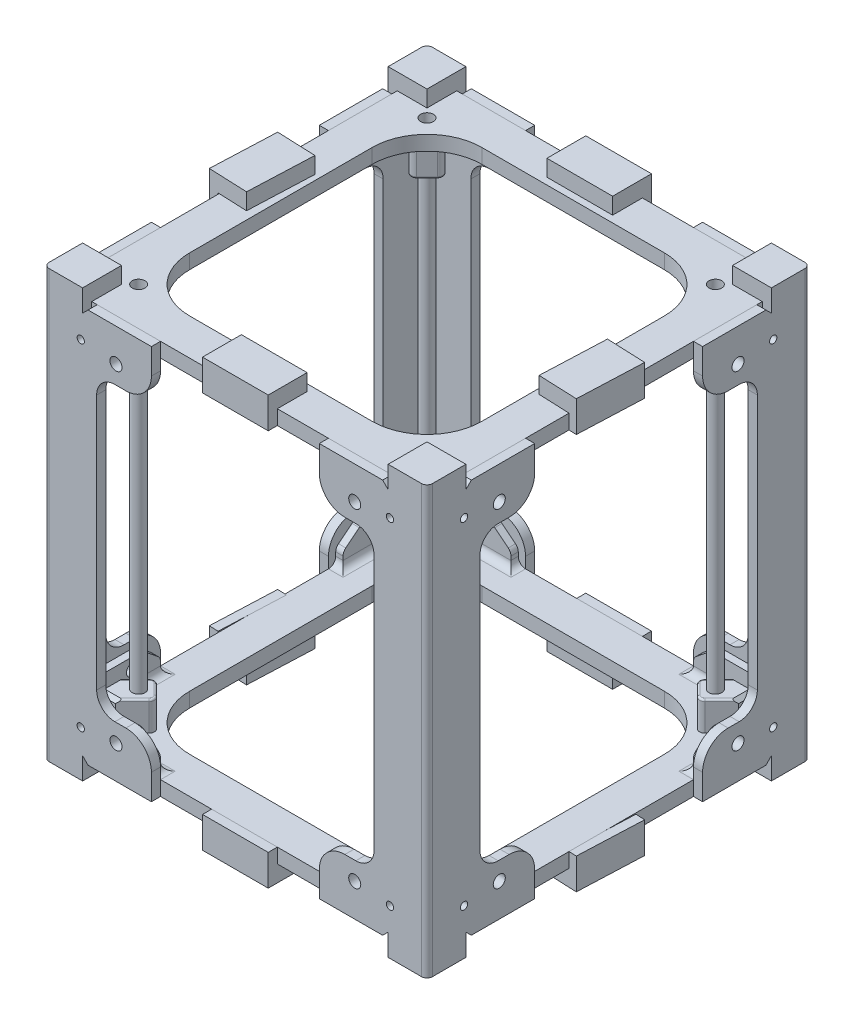
from build123d import *

# Parameters (mm, degrees)
SKETCH4_W                = 100
SKETCH4_H                = 100
BOTTOM_PLATFORM_DEPTH    = 4
BOSS_EXTRUDE6_DEPTH      = 2.5
SKETCH9_W                = 8.15
SKETCH9_H                = 8.15
BOSS_EXTRUDE12_DEPTH     = 4.5
SKETCH10_W               = 2.5
SKETCH10_H               = 2.5
BOSS_EXTRUDE13_DEPTH     = 58.5
BOSS_EXTRUDE14_DEPTH     = 2
SKETCH12_W               = 2
SKETCH12_H               = 2
BOSS_EXTRUDE15_DEPTH     = 8
FILLET1_R                = 2
FILLET2_R                = 2
FILLET5_R                = 2
SKETCH13_R               = 1.75
BOSS_EXTRUDE16_DEPTH     = 8
SKETCH13_3_R             = 1.75
BOSS_EXTRUDE17_DEPTH     = 50
SKETCH14_R               = 1
CUT_EXTRUDE2_DEPTH       = 9
SKETCH13_4_R             = 1.75
CUT_EXTRUDE3_DEPTH       = 132.471479797
CHAMFER1_SIZE            = 1
FILLET6_R                = 0.5
CUT_EXTRUDE4_START       = -4.5
SKETCH15_R               = 1.65
CUT_EXTRUDE4_DEPTH       = 4.5
MIRROR24_COPY_1_SKETCH_R = 1
MIRROR24_COPY_1_DEPTH    = 9
MIRROR24_START           = -4.5
MIRROR24_COPY_2_SKETCH_R = 1.65
MIRROR24_COPY_2_DEPTH    = 4.5
FILLET7_R                = 1.5
MIRROR27_START           = 104
MIRROR27_OUTLINE_R       = 1.75
MIRROR27_DEPTH           = 4
MIRROR29_COPY_1_SKETCH_R = 1
MIRROR29_COPY_1_DEPTH    = 9
MIRROR29_COPY_2_SKETCH_R = 1.75
MIRROR29_COPY_2_DEPTH    = 132.471479797
MIRROR29_START           = -4.5
MIRROR29_COPY_3_SKETCH_R = 1.65
MIRROR29_COPY_3_DEPTH    = 4.5
MIRROR29_COPY_4_SKETCH_R = 1.75
MIRROR29_COPY_4_DEPTH    = 132.471479797
MIRROR31_COPY_1_SKETCH_R = 1
MIRROR31_COPY_1_DEPTH    = 9
MIRROR36_COPY_1_SKETCH_R = 1
MIRROR36_COPY_1_DEPTH    = 9
MIRROR36_START           = -4.5
MIRROR36_COPY_2_SKETCH_R = 1.65
MIRROR36_COPY_2_DEPTH    = 4.5
SKETCH16_W               = 18
SKETCH16_H               = 8.15
SKETCH16_H_2             = 2.5
BOSS_EXTRUDE18_DEPTH     = 4.5
SKETCH17_W               = 18
SKETCH17_H               = 2.5
BOSS_EXTRUDE19_DEPTH     = 4


with BuildPart() as part:
    # Sketch4 → Bottom Platform (new body)
    with BuildSketch(Plane(origin=(0, 0, 0), x_dir=(1, 0, 0), z_dir=(0, 1, 0))):
        Rectangle(SKETCH4_W, SKETCH4_H)
        with BuildLine():
            Line((-25, 40), (25, 40))
            ThreePointArc((25, 40), (35.606601718, 35.606601718), (40, 25))
            Line((40, 25), (40, -25))
            ThreePointArc((40, -25), (35.606601718, -35.606601718), (25, -40))
            Line((25, -40), (-25, -40))
            ThreePointArc((-25, -40), (-35.606601718, -35.606601718), (-40, -25))
            Line((-40, -25), (-40, 25))
            ThreePointArc((-40, 25), (-35.606601718, 35.606601718), (-25, 40))
        make_face(mode=Mode.SUBTRACT)
    extrude(amount=BOTTOM_PLATFORM_DEPTH)


with BuildPart() as body_2:
    # Sketch5 → Boss-Extrude6 (new body)
    with BuildSketch(Plane.XY.offset(50)):
        with BuildLine():
            ThreePointArc((30, 14), (25.050252532, 11.949747468), (23, 7))
            Line((23, 7), (23, 0))
            Line((23, 0), (40.35, 0))
            Line((40.35, 0), (41.85, 1.5))
            Line((41.85, 1.5), (41.85, -4.5))
            Line((41.85, -4.5), (50, -4.5))
            Line((50, -4.5), (50, 54))
            Line((50, 54), (38, 54))
            Line((38, 54), (38, 19))
            ThreePointArc((38, 19), (36.535533906, 15.464466094), (33, 14))
            Line((33, 14), (30, 14))
        make_face()
    extrude(amount=BOSS_EXTRUDE6_DEPTH)


with BuildPart() as body_3:
    # Mirror2: mirrored copy
    add(body_2.part.mirror(Plane(origin=(0, 0, 0), x_dir=(0.7071067811865478, 0, 0.7071067811865472), z_dir=(-0.7071067811865475, 0, 0.7071067811865477))))


with BuildPart() as body_4:
    # Sketch9 → Boss-Extrude12 (new body)
    with BuildSketch(Plane.XZ):
        with Locations((45.925, 45.925)):
            Rectangle(SKETCH9_W, SKETCH9_H)
    extrude(amount=BOSS_EXTRUDE12_DEPTH)


with BuildPart() as body_2_1:
    add(body_2.part)

    add(body_3.part)  # Boss-Extrude13 merges body 3

    add(body_4.part)  # Boss-Extrude13 merges body 4
    # Sketch10 → Boss-Extrude13 (add)
    with BuildSketch(Plane.XZ.offset(4.5)):
        with Locations((51.25, 51.25)):
            Rectangle(SKETCH10_W, SKETCH10_H)
    extrude(amount=-BOSS_EXTRUDE13_DEPTH)

    # Mirror12: body 2 across plane


with BuildPart() as body_2_2:
    add(body_2_1.part)
    add(body_2_1.part.mirror(Plane(origin=(0, 54, 52.5), x_dir=(0, 0, 1), z_dir=(0, 1, 0))))


with BuildPart() as body_3_2:
    # Sketch11 → Boss-Extrude14 (new body)
    with BuildSketch(Plane.XY.offset(50)):
        Polygon((25, 8), (25, 4), (48, 4), (48, 12), (30, 12), align=None)
    extrude(amount=-BOSS_EXTRUDE14_DEPTH)


with BuildPart() as body_4_2:
    # Mirror13: mirrored copy
    add(body_3_2.part.mirror(Plane(origin=(0, 0, 0), x_dir=(0.7071067811865478, 0, 0.7071067811865472), z_dir=(-0.7071067811865475, 0, 0.7071067811865477))))


with BuildPart() as body_5:
    # Sketch12 → Boss-Extrude15 (new body)
    with BuildSketch(Plane(origin=(0, 4, 0), x_dir=(1, 0, 0), z_dir=(0, 1, 0))):
        with Locations((49, -49)):
            Rectangle(SKETCH12_W, SKETCH12_H)
    extrude(amount=BOSS_EXTRUDE15_DEPTH)


with BuildPart() as body_4_2_1:
    add(body_4_2.part)

    # Combine1: union body 5, body 3 2
    add(body_5.part)
    add(body_3_2.part)

    # Fillet1
    fillet1_edges = [body_4_2_1.edges().sort_by_distance(p)[0] for p in [
        (48, 8, 48),
    ]]
    fillet(fillet1_edges, radius=FILLET1_R)

    # Fillet2
    fillet2_edges = [body_4_2_1.edges().sort_by_distance(p)[0] for p in [
        (49, 8, 25),
        (49, 12, 30),
        (30, 12, 49),
        (25, 8, 49),
    ]]
    fillet(fillet2_edges, radius=FILLET2_R)


with BuildPart() as body_4_3:
    # Mirror14: mirrored copy
    add(body_4_2_1.part.mirror(Plane.XY))


with BuildPart() as body_5_2:
    # Mirror15: mirrored copy
    add(body_4_3.part.mirror(Plane.ZY))


with BuildPart() as body_6:
    # Mirror15 2: mirrored copy
    add(body_4_2_1.part.mirror(Plane.ZY))


with BuildPart() as body_4_3_1:
    add(body_4_3.part)

    # Combine2: union body 5 2, body 4 2, body 6, part
    add(body_5_2.part)
    add(body_4_2_1.part)
    add(body_6.part)
    add(part.part)

    # Fillet5
    fillet5_edges = [body_4_3_1.edges().sort_by_distance(p)[0] for p in [
        (-35.5, 4, -48),
        (-25, 4, -49),
        (35.5, 4, 48),
        (25, 4, 49),
        (-49, 4, 25),
        (-48, 4, 35.5),
        (-47.414213562, 4, 47.414213562),
        (-47.414213562, 4, -47.414213562),
        (-48, 4, -35.5),
        (-49, 4, -25),
        (-35.5, 4, 48),
        (-25, 4, 49),
        (47.414213562, 4, 47.414213562),
        (48, 4, 35.5),
        (49, 4, 25),
        (49, 4, -25),
        (25, 4, -49),
        (35.5, 4, -48),
        (48, 4, -35.5),
        (47.414213562, 4, -47.414213562),
    ]]
    fillet(fillet5_edges, radius=FILLET5_R)


with BuildPart() as body_3_3:
    # Mirror18: mirrored copy
    add(body_4_3_1.part.mirror(Plane.ZX.offset(54)))


with BuildPart() as body_4_4:
    # Sketch13 → Boss-Extrude16 (new body)
    with BuildSketch(Plane(origin=(0, 4, 0), x_dir=(1, 0, 0), z_dir=(0, 1, 0))):
        with BuildLine():
            Line((40.202795796, -45.152543264), (35.606601718, -40.556349186))
            ThreePointArc((35.606601718, -40.556349186), (35.16726189, -39.495689014), (35.606601718, -38.435028843))
            Line((35.606601718, -38.435028843), (38.435028843, -35.606601718))
            ThreePointArc((38.435028843, -35.606601718), (39.495689014, -35.16726189), (40.556349186, -35.606601718))
            Line((40.556349186, -35.606601718), (45.152543264, -40.202795796))
            Line((45.152543264, -40.202795796), (45.152543264, -45.152543264))
            Line((45.152543264, -45.152543264), (40.202795796, -45.152543264))
        make_face()
        with Locations(Location((39.495689014, -39.495689014, 0), (0, 0, 270))):
            Circle(SKETCH13_R, mode=Mode.SUBTRACT)
    extrude(amount=BOSS_EXTRUDE16_DEPTH)


with BuildPart() as body_5_3:
    # Sketch13<3> → Boss-Extrude17 (new body)
    with BuildSketch(Plane(origin=(0, 4, 0), x_dir=(1, 0, 0), z_dir=(0, 1, 0))):
        with Locations(Location((39.495689014, -39.495689014, 0), (0, 0, 270))):
            Circle(SKETCH13_3_R)
    extrude(amount=BOSS_EXTRUDE17_DEPTH)


with BuildPart() as cut_extrude2_tool:
    # Sketch14 → Cut-Extrude2 (new body)
    with BuildSketch(Plane.XY.offset(52.5)):
        with Locations((42.352543264, 8)):
            Circle(SKETCH14_R)
    cut_extrude2 = extrude(amount=-CUT_EXTRUDE2_DEPTH)


with BuildPart() as body_2_3:
    add(body_2_2.part)

    # Cut-Extrude2: cut by cut_extrude2_tool
    add(cut_extrude2_tool.part, mode=Mode.SUBTRACT)


with BuildPart() as body_4_3_2:
    add(body_4_3_1.part)

    # Cut-Extrude2: cut by cut_extrude2_tool
    add(cut_extrude2_tool.part, mode=Mode.SUBTRACT)

    # Sketch13<4> → Cut-Extrude3 (cut, through all)
    with BuildSketch(Plane(origin=(0, 4, 0), x_dir=(1, 0, 0), z_dir=(0, 1, 0))):
        with Locations(Location((39.495689014, -39.495689014, 0), (0, 0, 270))):
            Circle(SKETCH13_4_R)
    cut_extrude3 = extrude(amount=-CUT_EXTRUDE3_DEPTH, mode=Mode.SUBTRACT)


with BuildPart() as body_4_4_1:
    add(body_4_4.part)

    # Cut-Extrude2: cut by cut_extrude2_tool
    add(cut_extrude2_tool.part, mode=Mode.SUBTRACT)


with BuildPart() as mirror19_tool:
    # Mirror19: Cut-Extrude2 across plane
    add(cut_extrude2.mirror(Plane(origin=(0, 0, 0), x_dir=(0.7071067811865478, 0, 0.7071067811865472), z_dir=(-0.7071067811865475, 0, 0.7071067811865477))))


with BuildPart() as body_2_4:
    add(body_2_3.part)

    # Mirror19: cut by mirror19_tool
    add(mirror19_tool.part, mode=Mode.SUBTRACT)


with BuildPart() as body_4_3_3:
    add(body_4_3_2.part)

    # Mirror19: cut by mirror19_tool
    add(mirror19_tool.part, mode=Mode.SUBTRACT)


with BuildPart() as body_4_4_2:
    add(body_4_4_1.part)

    # Mirror19: cut by mirror19_tool
    add(mirror19_tool.part, mode=Mode.SUBTRACT)

    # Chamfer1
    chamfer1_edges = [body_4_4_2.edges().sort_by_distance(p)[0] for p in [
        (42.67766953, 12, 45.152543264),
        (45.152543264, 12, 42.67766953),
    ]]
    chamfer(chamfer1_edges, length=CHAMFER1_SIZE)

    # Fillet6
    fillet6_edges = [body_4_4_2.edges().sort_by_distance(p)[0] for p in [
        (39.495689014, 12, 35.16726189),
        (37.02081528, 12, 37.02081528),
        (35.16726189, 12, 39.495689014),
        (42.354446225, 12, 37.404698757),
        (37.404698757, 12, 42.354446225),
    ]]
    fillet(fillet6_edges, radius=FILLET6_R)


with BuildPart() as cut_extrude4_tool:
    # Sketch15 → Cut-Extrude4 (new body)
    with BuildSketch(Plane.XY.offset(52.5).offset(CUT_EXTRUDE4_START)):
        with Locations((32.701562119, 9)):
            Circle(SKETCH15_R)
    cut_extrude4 = extrude(amount=CUT_EXTRUDE4_DEPTH)


with BuildPart() as body_2_5:
    add(body_2_4.part)

    # Cut-Extrude4: cut by cut_extrude4_tool
    add(cut_extrude4_tool.part, mode=Mode.SUBTRACT)


with BuildPart() as body_4_3_4:
    add(body_4_3_3.part)

    # Cut-Extrude4: cut by cut_extrude4_tool
    add(cut_extrude4_tool.part, mode=Mode.SUBTRACT)


with BuildPart() as mirror21_tool:
    # Mirror21: Cut-Extrude4 across plane
    add(cut_extrude4.mirror(Plane(origin=(0, 0, 0), x_dir=(0.7071067811865478, 0, 0.7071067811865472), z_dir=(-0.7071067811865475, 0, 0.7071067811865477))))


with BuildPart() as body_2_6:
    add(body_2_5.part)

    # Mirror21: cut by mirror21_tool
    add(mirror21_tool.part, mode=Mode.SUBTRACT)


with BuildPart() as body_4_3_5:
    add(body_4_3_4.part)

    # Mirror21: cut by mirror21_tool
    add(mirror21_tool.part, mode=Mode.SUBTRACT)

    # Mirror28: Cut-Extrude3 across plane
    add(cut_extrude3.mirror(Plane.XY), mode=Mode.SUBTRACT)


with BuildPart() as body_6_2:
    # Mirror22: mirrored copy
    add(body_5_3.part.mirror(Plane.ZX.offset(54)))


with BuildPart() as body_7:
    # Mirror22 2: mirrored copy
    add(body_4_4_2.part.mirror(Plane.ZX.offset(54)))


with BuildPart() as mirror23_tool:
    # Mirror23: Cut-Extrude2, Cut-Extrude3, Cut-Extrude4 across plane
    add(cut_extrude2.mirror(Plane.ZX.offset(54)))
    add(cut_extrude3.mirror(Plane.ZX.offset(54)))
    add(cut_extrude4.mirror(Plane.ZX.offset(54)))


with BuildPart() as body_2_7:
    add(body_2_6.part)

    # Mirror23: cut by mirror23_tool
    add(mirror23_tool.part, mode=Mode.SUBTRACT)


with BuildPart() as body_3_3_1:
    add(body_3_3.part)

    # Mirror23: cut by mirror23_tool
    add(mirror23_tool.part, mode=Mode.SUBTRACT)


with BuildPart() as mirror24_copy_1_tool:
    # Mirror24 copy 1 sketch → Mirror24 copy 1 (new body)
    with BuildSketch(Plane(origin=(52.5, 108, 0), x_dir=(0, 0, 1), z_dir=(1, 0, 0))):
        with Locations((42.352543264, 8)):
            Circle(MIRROR24_COPY_1_SKETCH_R)
    extrude(amount=-MIRROR24_COPY_1_DEPTH)


with BuildPart() as body_2_8:
    add(body_2_7.part)

    # Mirror24 copy 1: cut by mirror24_copy_1_tool
    add(mirror24_copy_1_tool.part, mode=Mode.SUBTRACT)


with BuildPart() as body_3_3_2:
    add(body_3_3_1.part)

    # Mirror24 copy 1: cut by mirror24_copy_1_tool
    add(mirror24_copy_1_tool.part, mode=Mode.SUBTRACT)


with BuildPart() as mirror24_copy_2_tool:
    # Mirror24 copy 2 sketch → Mirror24 copy 2 (new body)
    with BuildSketch(Plane(origin=(52.5, 108, 0), x_dir=(0, 0, 1), z_dir=(1, 0, 0)).offset(MIRROR24_START)):
        with Locations((32.701562119, 9)):
            Circle(MIRROR24_COPY_2_SKETCH_R)
    extrude(amount=MIRROR24_COPY_2_DEPTH)


with BuildPart() as body_2_9:
    add(body_2_8.part)

    # Mirror24 copy 2: cut by mirror24_copy_2_tool
    add(mirror24_copy_2_tool.part, mode=Mode.SUBTRACT)

    # Fillet7
    fillet7_edges = [body_2_9.edges().sort_by_distance(p)[0] for p in [
        (52.5, 54, 52.5),
    ]]
    fillet(fillet7_edges, radius=FILLET7_R)


with BuildPart() as body_3_3_3:
    add(body_3_3_2.part)

    # Mirror24 copy 2: cut by mirror24_copy_2_tool
    add(mirror24_copy_2_tool.part, mode=Mode.SUBTRACT)

    # Mirror27: read off the stored shape, not the designer's step
    # Mirror27 outline → Mirror27 (cut)
    with BuildSketch(Plane(origin=(0, 0, 0), x_dir=(1, 0, 0), z_dir=(0, 1, 0)).offset(MIRROR27_START)):
        with Locations((39.495689014, 39.495689014)):
            Circle(MIRROR27_OUTLINE_R)
    mirror27 = extrude(amount=MIRROR27_DEPTH, mode=Mode.SUBTRACT)


with BuildPart() as body_5_3_1:
    add(body_5_3.part)

    # Combine3: read off the stored shape, not the designer's step
    # Combine3: union body 6 2
    add(body_6_2.part)


with BuildPart() as body_7_2:
    # Mirror25: mirrored copy
    add(body_2_9.part.mirror(Plane.XY))


with BuildPart() as body_8:
    # Mirror25 2: mirrored copy
    add(body_4_4_2.part.mirror(Plane.XY))


with BuildPart() as body_9:
    # Mirror25 3: mirrored copy
    add(body_5_3_1.part.mirror(Plane.XY))


with BuildPart() as body_10:
    # Mirror25 4: mirrored copy
    add(body_7.part.mirror(Plane.XY))


with BuildPart() as body_11:
    # Mirror26: mirrored copy
    add(body_5_3_1.part.mirror(Plane.ZY))


with BuildPart() as body_12:
    # Mirror26 2: mirrored copy
    add(body_2_9.part.mirror(Plane.ZY))


with BuildPart() as body_13:
    # Mirror26 3: mirrored copy
    add(body_4_4_2.part.mirror(Plane.ZY))


with BuildPart() as body_14:
    # Mirror26 4: mirrored copy
    add(body_7.part.mirror(Plane.ZY))


with BuildPart() as body_15:
    # Mirror26 5: mirrored copy
    add(body_10.part.mirror(Plane.ZY))


with BuildPart() as body_16:
    # Mirror26 6: mirrored copy
    add(body_7_2.part.mirror(Plane.ZY))


with BuildPart() as body_17:
    # Mirror26 7: mirrored copy
    add(body_9.part.mirror(Plane.ZY))


with BuildPart() as body_18:
    # Mirror26 8: mirrored copy
    add(body_8.part.mirror(Plane.ZY))


with BuildPart() as mirror29_tool:
    # Mirror29: Cut-Extrude2, Cut-Extrude3, Cut-Extrude4, Mirror27 across plane
    add(cut_extrude2.mirror(Plane.ZY))
    add(cut_extrude3.mirror(Plane.ZY))
    add(cut_extrude4.mirror(Plane.ZY))
    add(mirror27.mirror(Plane.ZY))


with BuildPart() as body_4_3_6:
    add(body_4_3_5.part)

    # Mirror29: cut by mirror29_tool
    add(mirror29_tool.part, mode=Mode.SUBTRACT)

    # Mirror29 copy 4 sketch → Mirror29 copy 4 (cut, through all)
    with BuildSketch(Plane(origin=(0, 4, 0), x_dir=(-1, 0, 0), z_dir=(0, 1, 0))):
        with Locations(Location((39.495689014, -39.495689014, 0), (0, 0, 270))):
            Circle(MIRROR29_COPY_4_SKETCH_R)
    extrude(amount=-MIRROR29_COPY_4_DEPTH, mode=Mode.SUBTRACT)

    # Mirror30: Cut-Extrude2 across plane
    add(cut_extrude2.mirror(Plane.XY), mode=Mode.SUBTRACT)

    # Mirror31 copy 1 sketch → Mirror31 copy 1 (cut)
    with BuildSketch(Plane(origin=(52.5, 0, 0), x_dir=(0, 0, -1), z_dir=(1, 0, 0))):
        with Locations((42.352543264, 8)):
            Circle(MIRROR31_COPY_1_SKETCH_R)
    extrude(amount=-MIRROR31_COPY_1_DEPTH, mode=Mode.SUBTRACT)

    # Mirror36 copy 1 sketch → Mirror36 copy 1 (cut)
    with BuildSketch(Plane.ZY.offset(52.5)):
        with Locations((42.352543264, 8)):
            Circle(MIRROR36_COPY_1_SKETCH_R)
    extrude(amount=-MIRROR36_COPY_1_DEPTH, mode=Mode.SUBTRACT)

    # Mirror36 copy 2 sketch → Mirror36 copy 2 (cut)
    with BuildSketch(Plane.ZY.offset(52.5).offset(MIRROR36_START)):
        with Locations((32.701562119, 9)):
            Circle(MIRROR36_COPY_2_SKETCH_R)
    extrude(amount=MIRROR36_COPY_2_DEPTH, mode=Mode.SUBTRACT)


with BuildPart() as body_3_3_4:
    add(body_3_3_3.part)

    # Mirror29: cut by mirror29_tool
    add(mirror29_tool.part, mode=Mode.SUBTRACT)

    # Mirror29 copy 1 sketch → Mirror29 copy 1 (cut)
    with BuildSketch(Plane(origin=(0, 108, 52.5), x_dir=(-1, 0, 0), z_dir=(0, 0, 1))):
        with Locations((42.352543264, 8)):
            Circle(MIRROR29_COPY_1_SKETCH_R)
    extrude(amount=-MIRROR29_COPY_1_DEPTH, mode=Mode.SUBTRACT)

    # Mirror29 copy 2 sketch → Mirror29 copy 2 (cut, through all)
    with BuildSketch(Plane(origin=(0, 104, 0), x_dir=(-1, 0, 0), z_dir=(0, -1, 0))):
        with Locations(Location((39.495689014, -39.495689014, 0), (0, 0, 270))):
            Circle(MIRROR29_COPY_2_SKETCH_R)
    extrude(amount=-MIRROR29_COPY_2_DEPTH, mode=Mode.SUBTRACT)

    # Mirror29 copy 3 sketch → Mirror29 copy 3 (cut)
    with BuildSketch(Plane(origin=(0, 108, 52.5), x_dir=(-1, 0, 0), z_dir=(0, 0, 1)).offset(MIRROR29_START)):
        with Locations((32.701562119, 9)):
            Circle(MIRROR29_COPY_3_SKETCH_R)
    extrude(amount=MIRROR29_COPY_3_DEPTH, mode=Mode.SUBTRACT)


with BuildPart() as body_19:
    # Sketch16 → Boss-Extrude18 (new body)
    with BuildSketch(Plane(origin=(0, 108, 0), x_dir=(1, 0, 0), z_dir=(0, 1, 0))):
        with Locations((0, -45.925)):
            Rectangle(SKETCH16_W, SKETCH16_H)
        with Locations((0, -51.25)):
            Rectangle(SKETCH16_W, SKETCH16_H_2)
    extrude(amount=BOSS_EXTRUDE18_DEPTH)

    # Sketch17 → Boss-Extrude19 (add)
    with BuildSketch(Plane.XZ.offset(-108)):
        with Locations((0, 51.25)):
            Rectangle(SKETCH17_W, SKETCH17_H)
    extrude(amount=BOSS_EXTRUDE19_DEPTH)


with BuildPart() as body_20:
    # Mirror37: mirrored copy
    add(body_19.part.mirror(Plane(origin=(0, 0, 0), x_dir=(0.6922479612777602, 0, 0.7216597259836416), z_dir=(-0.7216597259836418, 0, 0.6922479612777601))))


with BuildPart() as body_21:
    # Mirror38: mirrored copy
    add(body_20.part.mirror(Plane(origin=(0, 0, 0), x_dir=(-0.721659725983642, 0, 0.6922479612777596), z_dir=(-0.6922479612777598, 0, -0.721659725983642))))


with BuildPart() as body_22:
    # Mirror39: mirrored copy
    add(body_21.part.mirror(Plane(origin=(0, 0, 0), x_dir=(0.6922479612777602, 0, 0.7216597259836416), z_dir=(-0.7216597259836418, 0, 0.6922479612777601))))


with BuildPart() as body_23:
    # Mirror40: mirrored copy
    add(body_22.part.mirror(Plane.ZX.offset(54)))


with BuildPart() as body_24:
    # Mirror40 2: mirrored copy
    add(body_19.part.mirror(Plane.ZX.offset(54)))


with BuildPart() as body_25:
    # Mirror40 3: mirrored copy
    add(body_20.part.mirror(Plane.ZX.offset(54)))


with BuildPart() as body_26:
    # Mirror40 4: mirrored copy
    add(body_21.part.mirror(Plane.ZX.offset(54)))


solid = Compound([body_4_4_2.part, body_7.part, body_2_9.part, body_5_3_1.part, body_7_2.part, body_8.part, body_9.part, body_10.part, body_11.part, body_12.part, body_13.part, body_14.part, body_15.part, body_16.part, body_17.part, body_18.part, body_4_3_6.part, body_3_3_4.part, body_19.part, body_20.part, body_21.part, body_22.part, body_23.part, body_24.part, body_25.part, body_26.part])
